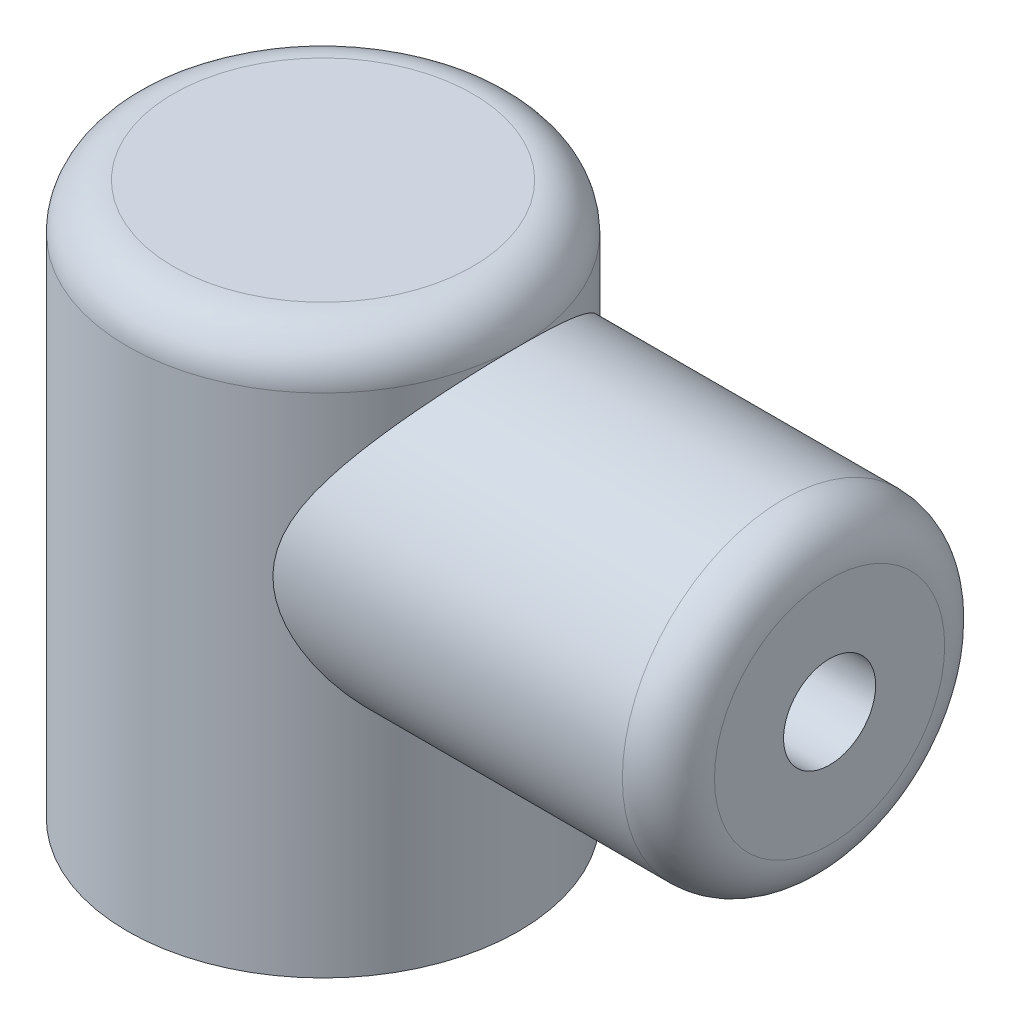
from build123d import *

# Parameters (mm, degrees)
SKETCH1_R           = 42.5
BOSS_EXTRUDE1_DEPTH = 120
SKETCH2_R           = 35
BOSS_EXTRUDE2_DEPTH = 110
FILLET1_R           = 10
SKETCH3_R           = 10
CUT_EXTRUDE1_DEPTH  = 40
FILLET2_R           = 10


with BuildPart() as part:
    # Sketch1 → Boss-Extrude1 (new body)
    with BuildSketch(Plane(origin=(0, 0, 0), x_dir=(1, 0, 0), z_dir=(0, 1, 0))):
        Circle(SKETCH1_R)
    extrude(amount=BOSS_EXTRUDE1_DEPTH)

    # Sketch2 → Boss-Extrude2 (add)
    with BuildSketch(Plane(origin=(0, 0, 0), x_dir=(0, 0, -1), z_dir=(1, 0, 0))):
        with Locations((0, 75)):
            Circle(SKETCH2_R)
    extrude(amount=BOSS_EXTRUDE2_DEPTH)

    # Fillet1
    fillet1_edges = [part.edges().sort_by_distance(p)[0] for p in [
        (-42.5, 120, 0),
    ]]
    fillet(fillet1_edges, radius=FILLET1_R)

    # Sketch3 → Cut-Extrude1 (cut)
    with BuildSketch(Plane(origin=(110, 0, 0), x_dir=(0, 0, -1), z_dir=(1, 0, 0))):
        with Locations((0, 75)):
            Circle(SKETCH3_R)
    extrude(amount=-CUT_EXTRUDE1_DEPTH, mode=Mode.SUBTRACT)

    # Fillet2
    fillet2_edges = [part.edges().sort_by_distance(p)[0] for p in [
        (110, 75, 35),
    ]]
    fillet(fillet2_edges, radius=FILLET2_R)


solid = part.part
